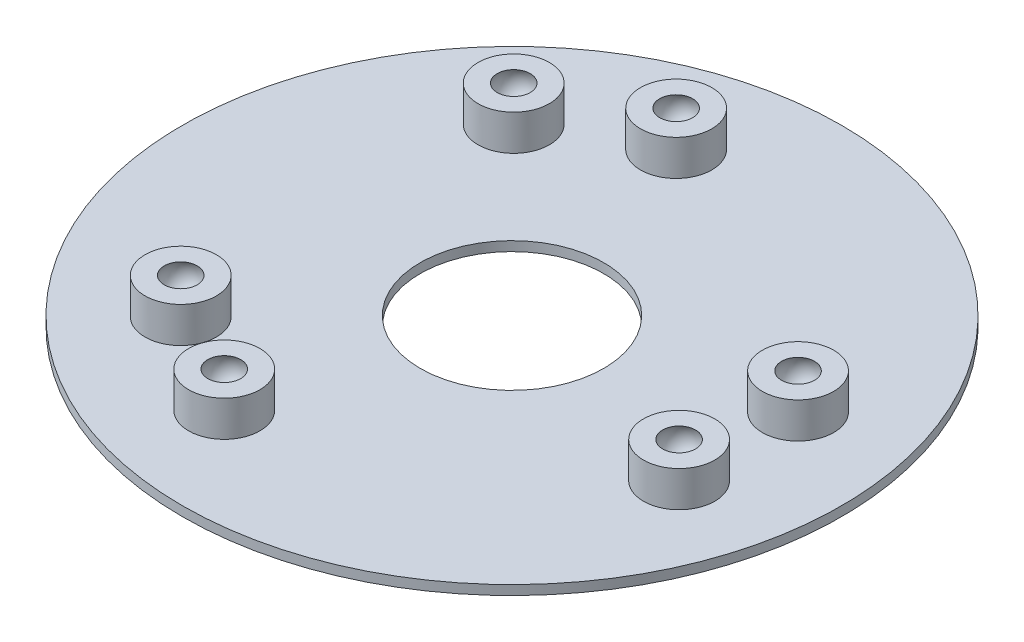
from build123d import *

# Parameters (mm, degrees)
SKETCH1_R          = 692.820324
SKETCH1_R_2        = 192.820324
EXTRUDE1_DEPTH     = 20
SKETCH2_R          = 75
CUT_EXTRUDE1_DEPTH = 10


# Read off the part's stored shape, not the designer's step: 连接重组1
with BuildPart() as part:
    # Sketch1 → Extrude1 (new body)
    with BuildSketch(Plane(origin=(0, 0, 0), x_dir=(1, 0, 0), z_dir=(0, 1, 0))):
        with Locations(Location((0, 0, 0), (0, 0, 270))):
            Circle(SKETCH1_R)
        with Locations(Location((0, 0, 0), (0, 0, 270))):
            Circle(SKETCH1_R_2, mode=Mode.SUBTRACT)
    extrude(amount=-EXTRUDE1_DEPTH)

    # Sketch2 → Cut-Extrude1 (cut)
    with BuildSketch(Plane(origin=(0, 0, 0), x_dir=(1, 0, 0), z_dir=(0, 1, 0))):
        with Locations(Location((-129.90381057, 475, 0), (0, 0, 270))):
            Circle(SKETCH2_R)
        with Locations(Location((-129.90381057, -475, 0), (0, 0, 270))):
            Circle(SKETCH2_R)
        with Locations(Location((476.314, -125, 0), (0, 0, 270))):
            Circle(SKETCH2_R)
        with Locations(Location((-346.4101615, 350, 0), (0, 0, 270))):
            Circle(SKETCH2_R)
        with Locations(Location((-346.4101615, -350, 0), (0, 0, 270))):
            Circle(SKETCH2_R)
        with Locations(Location((476.314, 125, 0), (0, 0, 270))):
            Circle(SKETCH2_R)
    extrude(amount=-CUT_EXTRUDE1_DEPTH, mode=Mode.SUBTRACT)

    # 连接重组1 outline → 连接重组1 (revolve)
    with BuildSketch(Plane(origin=(476.314, 0, 125), x_dir=(1, 0, 0), z_dir=(0, 0, 1))):
        with BuildLine():
            Line((75, 75), (34.641016131, 75.000000035))
            ThreePointArc((34.641016131, 75.000000035), (34.641016161, 35.000000018), (0, 15))
            Line((0, 15), (0, -10))
            Line((0, -10), (75, -10))
            Line((75, -10), (75, 75))
        make_face()
    revolve(axis=Axis((476.314, 0, 125), (0, 1, 0)))

    # Other 1 2 outline → Other 1 2 (revolve)
    with BuildSketch(Plane(origin=(-129.90381057, 0, 475), x_dir=(1, 0, 0), z_dir=(0, 0, 1))):
        with BuildLine():
            Line((75, 75), (34.641016131, 75.000000035))
            ThreePointArc((34.641016131, 75.000000035), (34.641016161, 35.000000018), (0, 15))
            Line((0, 15), (0, -10))
            Line((0, -10), (75, -10))
            Line((75, -10), (75, 75))
        make_face()
    revolve(axis=Axis((-129.90381057, 0, 475), (0, 1, 0)))

    # Other 1 3 outline → Other 1 3 (revolve)
    with BuildSketch(Plane(origin=(-346.4101615, 0, -350), x_dir=(1, 0, 0), z_dir=(0, 0, 1))):
        with BuildLine():
            Line((75, 75), (34.641016131, 75.000000035))
            ThreePointArc((34.641016131, 75.000000035), (34.641016161, 35.000000018), (0, 15))
            Line((0, 15), (0, -10))
            Line((0, -10), (75, -10))
            Line((75, -10), (75, 75))
        make_face()
    revolve(axis=Axis((-346.4101615, 0, -350), (0, 1, 0)))

    # Other 1 4 outline → Other 1 4 (revolve)
    with BuildSketch(Plane(origin=(-129.90381057, 0, -475), x_dir=(1, 0, 0), z_dir=(0, 0, 1))):
        with BuildLine():
            Line((75, 75), (34.641016131, 75.000000035))
            ThreePointArc((34.641016131, 75.000000035), (34.641016161, 35.000000018), (0, 15))
            Line((0, 15), (0, -10))
            Line((0, -10), (75, -10))
            Line((75, -10), (75, 75))
        make_face()
    revolve(axis=Axis((-129.90381057, 0, -475), (0, 1, 0)))

    # Other 1 5 outline → Other 1 5 (revolve)
    with BuildSketch(Plane(origin=(-346.4101615, 0, 350), x_dir=(1, 0, 0), z_dir=(0, 0, 1))):
        with BuildLine():
            Line((75, 75), (34.641016131, 75.000000035))
            ThreePointArc((34.641016131, 75.000000035), (34.641016161, 35.000000018), (0, 15))
            Line((0, 15), (0, -10))
            Line((0, -10), (75, -10))
            Line((75, -10), (75, 75))
        make_face()
    revolve(axis=Axis((-346.4101615, 0, 350), (0, 1, 0)))

    # Other 1 6 outline → Other 1 6 (revolve)
    with BuildSketch(Plane(origin=(476.314, 0, -125), x_dir=(1, 0, 0), z_dir=(0, 0, 1))):
        with BuildLine():
            Line((75, 75), (34.641016131, 75.000000035))
            ThreePointArc((34.641016131, 75.000000035), (34.641016161, 35.000000018), (0, 15))
            Line((0, 15), (0, -10))
            Line((0, -10), (75, -10))
            Line((75, -10), (75, 75))
        make_face()
    revolve(axis=Axis((476.314, 0, -125), (0, 1, 0)))


solid = part.part
